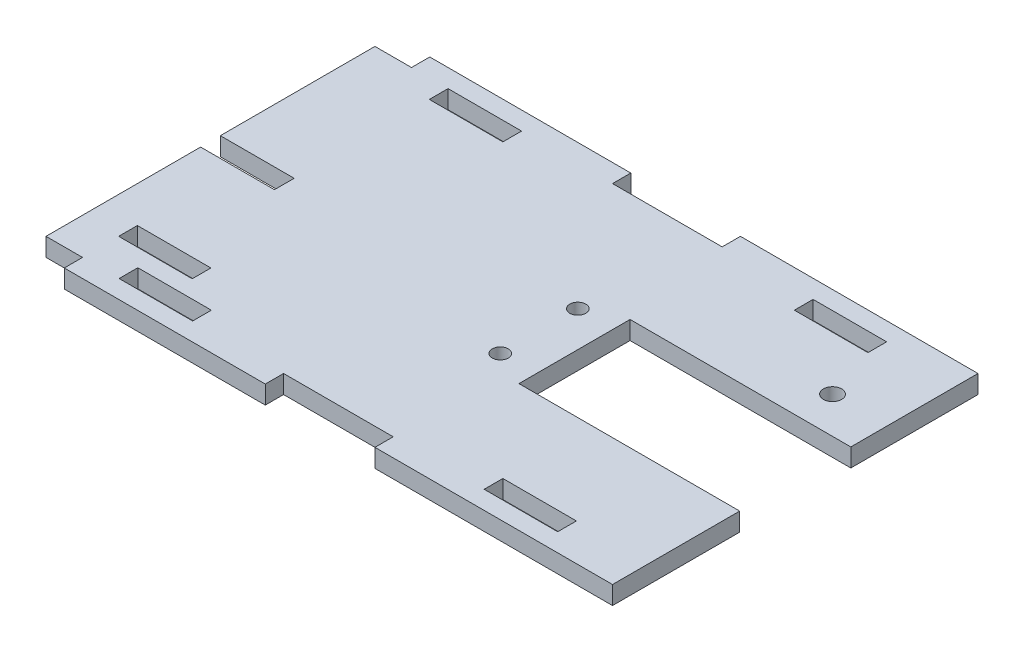
from build123d import *

# Parameters (mm, degrees)
BOSS_EXTRUDE1_DEPTH = 6.35
SKETCH4_W           = 25.5524
SKETCH4_H           = 6.5024
SKETCH4_W_2         = 12.7
SKETCH4_H_2         = 6.35
SKETCH4_W_3         = 38.1
CUT_EXTRUDE1_DEPTH  = 240.70724332
SKETCH5_R           = 3.175
CUT_EXTRUDE2_DEPTH  = 240.70724332
SKETCH6_R           = 2.778125
CUT_EXTRUDE3_DEPTH  = 240.70724332
SKETCH7_W           = 25.5524
SKETCH7_H           = 6.5024
CUT_EXTRUDE4_DEPTH  = 240.70724332


with BuildPart() as part:
    # Sketch1 → Boss-Extrude1 (new body)
    with BuildSketch(Plane(origin=(0, 0, 0), x_dir=(1, 0, 0), z_dir=(0, 1, 0))):
        Polygon((0, 60.071), (0, 0), (203.2, 0), (203.2, 44.196), (126.492, 44.196), (126.492, 82.804), (203.2, 82.804), (203.2, 127), (0, 127), (0, 66.929), (25.654, 66.929), (25.654, 60.071), align=None)
    extrude(amount=BOSS_EXTRUDE1_DEPTH)

    # Sketch4 → Cut-Extrude1 (cut, through all)
    with BuildSketch(Plane(origin=(0, 6.35, 0), x_dir=(1, 0, 0), z_dir=(0, 1, 0))):
        with Locations((38.1762, 117.3988)):
            Rectangle(SKETCH4_W, SKETCH4_H)
        with Locations((165.0238, 117.3988)):
            Rectangle(SKETCH4_W, SKETCH4_H)
        with Locations((38.1762, 9.6012)):
            Rectangle(SKETCH4_W, SKETCH4_H)
        with Locations((165.0238, 9.6012)):
            Rectangle(SKETCH4_W, SKETCH4_H)
        with Locations((6.35, 123.825)):
            Rectangle(SKETCH4_W_2, SKETCH4_H_2)
        with Locations((6.35, 3.175)):
            Rectangle(SKETCH4_W_2, SKETCH4_H_2)
        with Locations((101.6, 3.175)):
            Rectangle(SKETCH4_W_3, SKETCH4_H_2)
        with Locations((101.6, 123.825)):
            Rectangle(SKETCH4_W_3, SKETCH4_H_2)
    extrude(amount=-CUT_EXTRUDE1_DEPTH, mode=Mode.SUBTRACT)

    # Sketch5 → Cut-Extrude2 (cut, through all)
    with BuildSketch(Plane(origin=(0, 6.35, 0), x_dir=(1, 0, 0), z_dir=(0, 1, 0))):
        with Locations((184.15, 95.504)):
            Circle(SKETCH5_R)
    extrude(amount=-CUT_EXTRUDE2_DEPTH, mode=Mode.SUBTRACT)

    # Sketch6 → Cut-Extrude3 (cut, through all)
    with BuildSketch(Plane.XZ):
        with Locations((114.173, -50.038)):
            Circle(SKETCH6_R)
        with Locations((114.173, -76.962)):
            Circle(SKETCH6_R)
    extrude(amount=-CUT_EXTRUDE3_DEPTH, mode=Mode.SUBTRACT)

    # Sketch7 → Cut-Extrude4 (cut, through all)
    with BuildSketch(Plane(origin=(0, 6.35, 0), x_dir=(1, 0, 0), z_dir=(0, 1, 0))):
        with Locations((25.4, 22.225)):
            Rectangle(SKETCH7_W, SKETCH7_H)
    extrude(amount=-CUT_EXTRUDE4_DEPTH, mode=Mode.SUBTRACT)


solid = part.part
